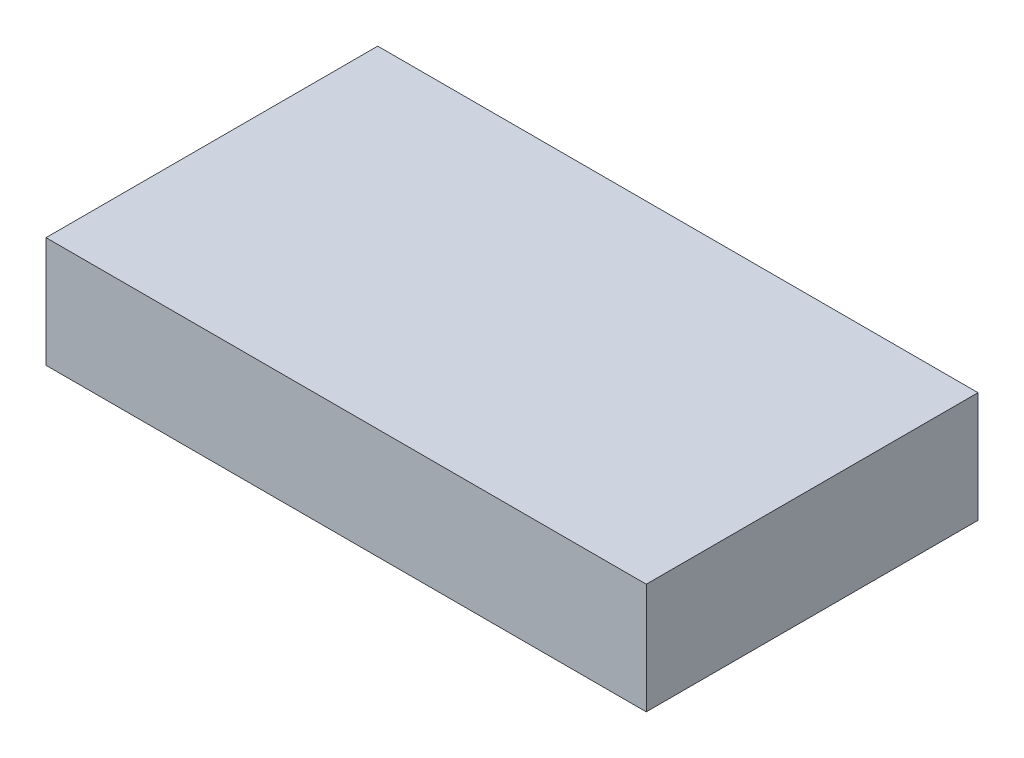
from build123d import *

# Parameters (mm, degrees)
SKETCH1_W           = 38
SKETCH1_H           = 21
BOSS_EXTRUDE1_DEPTH = 7


with BuildPart() as part:
    # Sketch1 → Boss-Extrude1 (new body)
    with BuildSketch(Plane(origin=(0, 0, 0), x_dir=(1, 0, 0), z_dir=(0, 1, 0))):
        with Locations((19, 10.5)):
            Rectangle(SKETCH1_W, SKETCH1_H)
    extrude(amount=BOSS_EXTRUDE1_DEPTH)


solid = part.part
